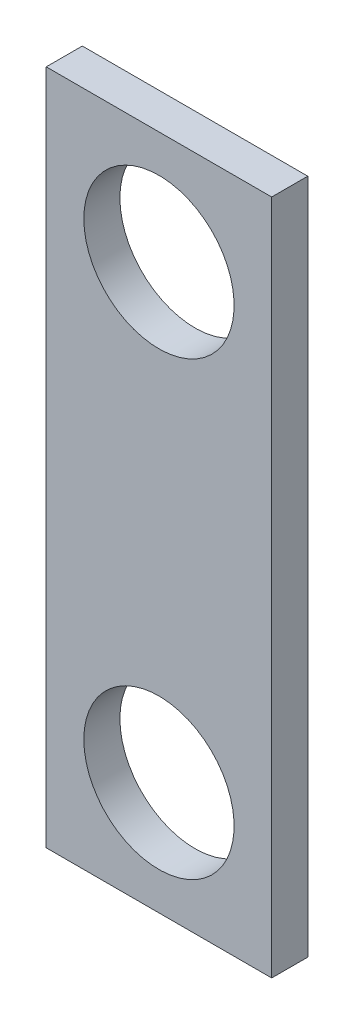
from build123d import *

# Parameters (mm, degrees)
SKETCH1_W           = 19.05
SKETCH1_H           = 57.15
SKETCH1_R           = 6.35
BOSS_EXTRUDE2_DEPTH = 3.048


with BuildPart() as part:
    # Sketch1 → Boss-Extrude2 (new body)
    with BuildSketch(Plane.XY):
        with Locations((0, -200.025)):
            Rectangle(SKETCH1_W, SKETCH1_H)
        with Locations((0, -180.975)):
            Circle(SKETCH1_R, mode=Mode.SUBTRACT)
        with Locations((0, -219.075)):
            Circle(SKETCH1_R, mode=Mode.SUBTRACT)
    extrude(amount=BOSS_EXTRUDE2_DEPTH)


solid = part.part
